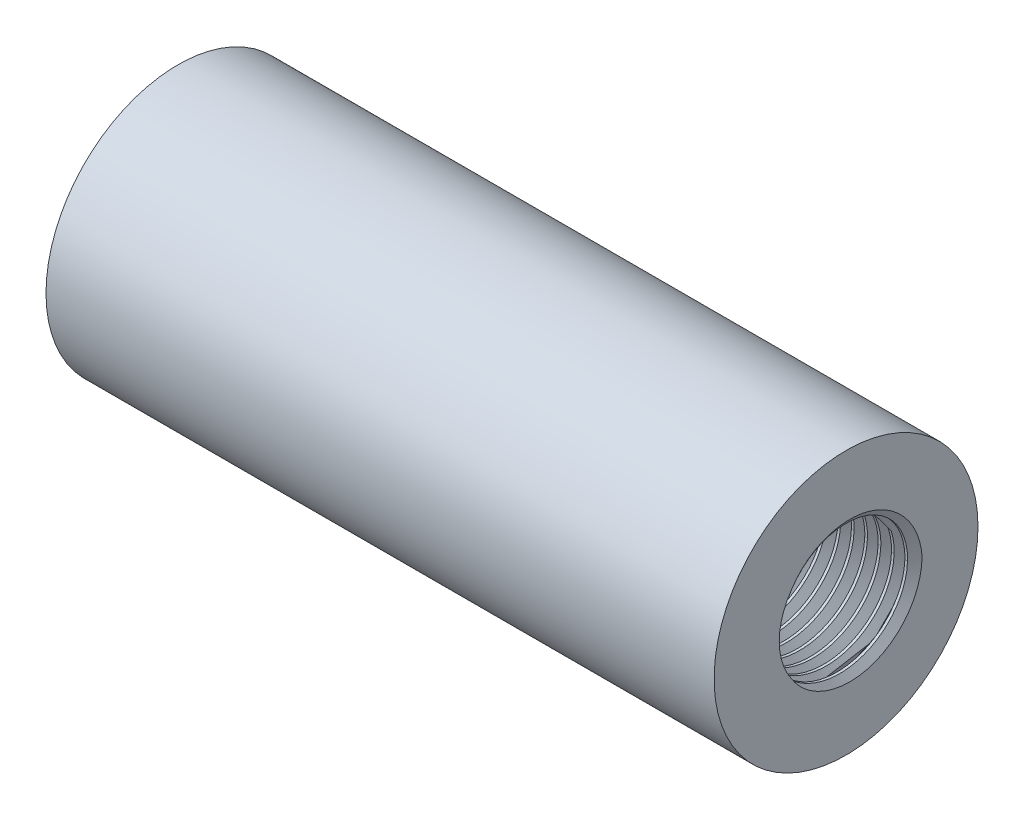
from build123d import *

# Parameters (mm, degrees)
SKETCH1_R           = 7.9375
BOSS_EXTRUDE1_DEPTH = 332
SKETCH2_R           = 2.5
CUT_EXTRUDE1_DEPTH  = 24
CUT_EXTRUDE2_START  = -24
SKETCH3_R           = 2.5
CUT_EXTRUDE2_DEPTH  = 24
CUT_SWEEP5_PITCH    = 0.5
CHAMFER1_SIZE       = 3
SKETCH10_OUTSIDE_W  = 84.428
SKETCH10_OUTSIDE_H  = 84.428
SKETCH10_OUTSIDE_R  = 4.9375
CUT_EXTRUDE3_DEPTH  = 333.189716597
CUT_EXTRUDE4_START  = -25
SKETCH13_W          = 10.868591336
SKETCH13_H          = 10.778582298
CUT_EXTRUDE4_DEPTH  = 308.073422325


with BuildPart() as part:
    # Sketch1 → Boss-Extrude1 (new body)
    with BuildSketch(Plane(origin=(0, 0, 0), x_dir=(0, 0, -1), z_dir=(1, 0, 0))):
        Circle(SKETCH1_R)
    extrude(amount=-BOSS_EXTRUDE1_DEPTH)

    # Sketch2 → Cut-Extrude1 (cut)
    with BuildSketch(Plane(origin=(0, 0, 0), x_dir=(0, 0, -1), z_dir=(1, 0, 0))):
        Circle(SKETCH2_R)
    extrude(amount=-CUT_EXTRUDE1_DEPTH, mode=Mode.SUBTRACT)

    # Sketch3 → Cut-Extrude2 (cut)
    with BuildSketch(Plane.ZY.offset(332).offset(CUT_EXTRUDE2_START)):
        with Locations(Location((0, 0, 0), (0, 0, 180))):
            Circle(SKETCH3_R)
    extrude(amount=CUT_EXTRUDE2_DEPTH, mode=Mode.SUBTRACT)

    # Cut-Sweep5: arcs per turn and ends read off the stored shape
    # Cut-Sweep5: the profile of 3DSketch6 profile screwed along a right-hand helix through 37 turns, 6 arcs to a turn; built about Z, then put on its axis
    cut_sweep5_z = Axis((0, 0, 0), (0, 0, 1))
    cut_sweep5_corners = [(2.4997, 0, -0.700174018), (2.4997, 0, -0.299828416), (2.847219747, 0, -0.498591157)]
    with BuildLine(mode=Mode.PRIVATE) as cut_sweep5_profile:
        Line(cut_sweep5_corners[0], cut_sweep5_corners[1])
        Line(cut_sweep5_corners[1], cut_sweep5_corners[2])
        Line(cut_sweep5_corners[2], cut_sweep5_corners[0])
    cut_sweep5_cap = Face(cut_sweep5_profile.wire())
    cut_sweep5_turn_angles = [0, 30, 60, 90, 120, 150, 180, 210, 240, 270, 300, 330, 360]
    cut_sweep5_turn_weights = [1, 0.8660254037844387, 1, 0.8660254037844387, 1, 0.8660254037844387, 1, 0.8660254037844387, 1, 0.8660254037844387, 1, 0.8660254037844387, 1]
    cut_sweep5_turn_rails = [Edge.make_bspline([Vector(p[0], p[1], 0).rotate(cut_sweep5_z, cut_sweep5_turn_angles[k]) / cut_sweep5_turn_weights[k] + Vector(0, 0, p[2] + CUT_SWEEP5_PITCH * cut_sweep5_turn_angles[k] / 360) for k in range(13)], [0, 0, 0, 1, 1, 2, 2, 3, 3, 4, 4, 5, 5, 6, 6, 6], 2, cut_sweep5_turn_weights) for p in cut_sweep5_corners]
    cut_sweep5_turn_sides = [Face.make_surface_from_curves(cut_sweep5_turn_rails[p[0]], cut_sweep5_turn_rails[p[1]]) for p in [(0, 1), (1, 2), (2, 0)]]
    cut_sweep5 = Plane(origin=(0, 0, 0), x_dir=(0, 0, -1), z_dir=(-1, 0, 0)) * Solid(Shell([*[p.moved(Location((0, 0, CUT_SWEEP5_PITCH * i))) for i in range(37) for p in cut_sweep5_turn_sides], cut_sweep5_cap, cut_sweep5_cap.rotate(cut_sweep5_z, 13320).moved(Location((0, 0, CUT_SWEEP5_PITCH * 13320 / 360)))]))
    add(cut_sweep5, mode=Mode.SUBTRACT)

    # Chamfer1
    chamfer1_edges = [part.edges().sort_by_distance(p)[0] for p in [
        (0, 0, 7.9375),
        (-332, 0, 7.9375),
    ]]
    chamfer(chamfer1_edges, length=CHAMFER1_SIZE)

    # Sketch10 outside → Cut-Extrude3 (cut, through all)
    with BuildSketch(Plane(origin=(0, 0, 0), x_dir=(0, 0, -1), z_dir=(1, 0, 0))):
        Rectangle(SKETCH10_OUTSIDE_W, SKETCH10_OUTSIDE_H)
        Circle(SKETCH10_OUTSIDE_R, mode=Mode.SUBTRACT)
    extrude(amount=-CUT_EXTRUDE3_DEPTH, mode=Mode.SUBTRACT)

    # Sketch13 → Cut-Extrude4 (cut, through all)
    with BuildSketch(Plane(origin=(0, 0, 0), x_dir=(0, 0, -1), z_dir=(1, 0, 0)).offset(CUT_EXTRUDE4_START)):
        with Locations((-0.122365751, -0.120016737)):
            Rectangle(SKETCH13_W, SKETCH13_H)
    extrude(amount=-CUT_EXTRUDE4_DEPTH, mode=Mode.SUBTRACT)


solid = part.part
